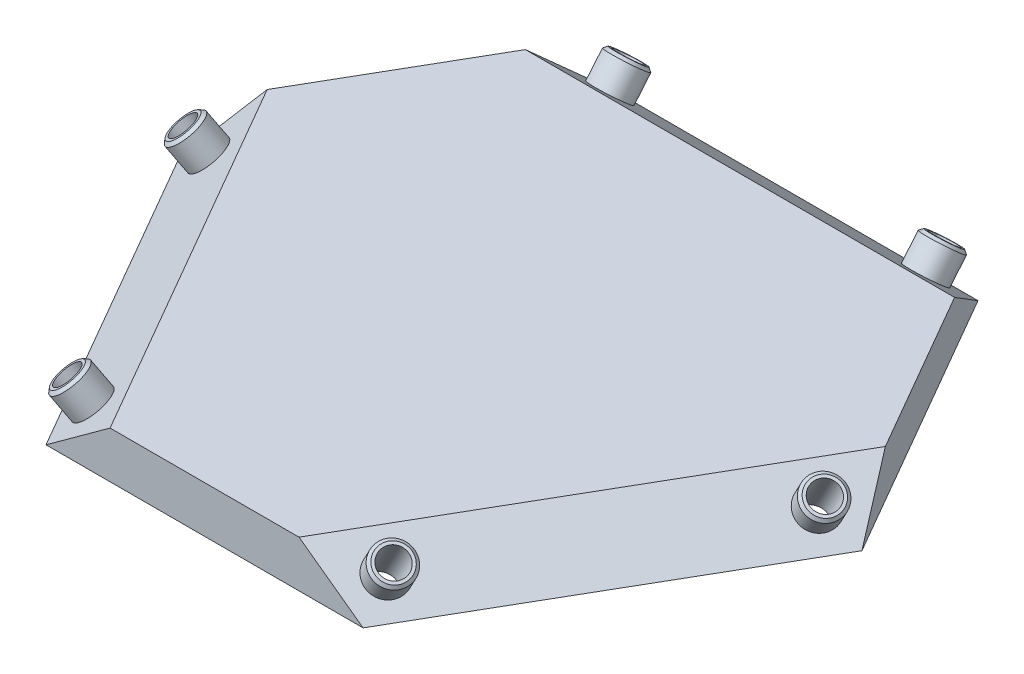
from build123d import *

# Parameters (mm, degrees)
BOSS_EXTRUDE1_DEPTH = 8
CHAMFER1_SIZE       = 10
CHAMFER1_SIZE_2     = 11.917535926
SKETCH4_R           = 2.3
CUT_EXTRUDE1_DEPTH  = 101.029376687
SKETCH7_R           = 2.3
CUT_EXTRUDE2_DEPTH  = 97.338690096
SKETCH6_R           = 2.3
CUT_EXTRUDE3_DEPTH  = 101.029376687
BOSS_EXTRUDE2_START = 5
SKETCH8_R           = 3.3
SKETCH8_R_2         = 2.3
BOSS_EXTRUDE2_DEPTH = 5
BOSS_EXTRUDE3_START = 5
SKETCH9_R           = 3.3
SKETCH9_R_2         = 2.3
BOSS_EXTRUDE3_DEPTH = 5
BOSS_EXTRUDE4_START = 5
SKETCH10_R          = 3.3
SKETCH10_R_2        = 2.3
BOSS_EXTRUDE4_DEPTH = 5
CHAMFER2_SIZE       = 0.5


with BuildPart() as part:
    # Sketch1 → Boss-Extrude1 (new body)
    with BuildSketch(Plane(origin=(0, 0, 0), x_dir=(1, 0, 0), z_dir=(0, 1, 0))):
        Polygon((-60, 0), (-30, -51.961524227), (30, -51.961524227), (60, 0), (30, 51.961524227), (-30, 51.961524227), align=None)
    extrude(amount=BOSS_EXTRUDE1_DEPTH)

    # Chamfer1
    # the kernel refuses this chamfer: 11.917535926, 10 mm, written as the material it takes off along each edge
    with BuildSketch(Plane(origin=(60.716329832, 8, -51.961524227), x_dir=(0, -0.9993728857116146, -0.0354095369136628), z_dir=(-1, 0, 0)), Plane(origin=(-75.358164916, 8, -26.601121946), x_dir=(-0.030665558503474466, -0.9993728857116146, 0.017704768456831187), z_dir=(0.4999999999999998, 0, 0.8660254037844388)), Plane(origin=(14.641835084, 8, 78.562646173), x_dir=(0.03066555850347504, -0.9993728857116146, 0.017704768456831523), z_dir=(0.4999999999999999, 0, -0.8660254037844388))) as chamfer1_piece_1:
        Polygon((CHAMFER1_SIZE * 0.999372885712, CHAMFER1_SIZE * 0.0354095369137), (-CHAMFER1_SIZE_2 * 0.0354095369135, CHAMFER1_SIZE_2 * 0.999372885707), (0, 0), align=None)
    extrude(amount=121.432659665, mode=Mode.SUBTRACT)

    # Sketch4 → Cut-Extrude1 (cut, through all)
    with BuildSketch(Plane(origin=(17.740047471, 24.412407781, 10.242221183), x_dir=(0.8301060005968417, -0.4979011414928852, -0.2510348204397117), z_dir=(0.5566703992264165, 0.766044443118981, 0.3213938048432679))):
        with Locations(Location((41.75562393, 0.929232239, 0), (0, 0, 164.627134315))):
            Circle(SKETCH4_R)
        with Locations(Location((7.440666851, -41.097835456, 0), (0, 0, 164.627134315))):
            Circle(SKETCH4_R)
    extrude(amount=-CUT_EXTRUDE1_DEPTH, mode=Mode.SUBTRACT)

    # Sketch7 → Cut-Extrude2 (cut, through all)
    with BuildSketch(Plane(origin=(0, 24.412407781, -20.484442365), x_dir=(1, 0, 0), z_dir=(0, 0.7660444431189811, -0.6427876096865357))):
        with Locations(Location((-27.128355545, 31.756069148, 0), (0, 0, 270))):
            Circle(SKETCH7_R)
        with Locations(Location((27.128355545, 31.756069148, 0), (0, 0, 270))):
            Circle(SKETCH7_R)
    extrude(amount=-CUT_EXTRUDE2_DEPTH, mode=Mode.SUBTRACT)

    # Sketch6 → Cut-Extrude3 (cut, through all)
    with BuildSketch(Plane(origin=(-17.740047471, 24.412407781, 10.242221183), x_dir=(0.8307334510088673, 0.5133226132381532, 0.21536440772154375), z_dir=(-0.5566703992264166, 0.766044443118981, 0.3213938048432678))):
        with Locations(Location((-41.687976983, 2.551112975, 0), (0, 0, 193.145847187))):
            Circle(SKETCH6_R)
        with Locations(Location((-9.032068506, -40.777657373, 0), (0, 0, 193.145847187))):
            Circle(SKETCH6_R)
    extrude(amount=-CUT_EXTRUDE3_DEPTH, mode=Mode.SUBTRACT)

    # Sketch8 → Boss-Extrude2 (add)
    # profile 1 of 2: a face of its own
    with BuildSketch(Plane(origin=(17.740047471, 24.412407781, 10.242221183), x_dir=(0.8307334510088674, -0.5133226132381531, -0.21536440772154372), z_dir=(0.5566703992264164, 0.766044443118981, 0.32139380484326796)).offset(BOSS_EXTRUDE2_START)):
        with Locations(Location((9.032068506, -40.777657373, 0), (0, 0, 166.854152813))):
            Circle(SKETCH8_R)
        with Locations(Location((9.032068506, -40.777657373, 0), (0, 0, 166.854152813))):
            Circle(SKETCH8_R_2, mode=Mode.SUBTRACT)
    # profile 2 of 2: a face of its own
    with BuildSketch(Plane(origin=(17.740047471, 24.412407781, 10.242221183), x_dir=(0.8307334510088674, -0.5133226132381531, -0.21536440772154372), z_dir=(0.5566703992264164, 0.766044443118981, 0.32139380484326796)).offset(BOSS_EXTRUDE2_START)):
        with Locations(Location((41.687976983, 2.551112975, 0), (0, 0, 166.854152813))):
            Circle(SKETCH8_R)
        with Locations(Location((41.687976983, 2.551112975, 0), (0, 0, 166.854152813))):
            Circle(SKETCH8_R_2, mode=Mode.SUBTRACT)
    extrude(amount=-BOSS_EXTRUDE2_DEPTH)

    # Sketch9 → Boss-Extrude3 (add)
    # profile 1 of 2: a face of its own
    with BuildSketch(Plane(origin=(-17.740047471, 24.412407781, 10.242221183), x_dir=(0.8307334510088673, 0.5133226132381532, 0.21536440772154375), z_dir=(-0.5566703992264166, 0.766044443118981, 0.3213938048432678)).offset(BOSS_EXTRUDE3_START)):
        with Locations(Location((-41.687976983, 2.551112975, 0), (0, 0, 193.145847187))):
            Circle(SKETCH9_R)
        with Locations(Location((-41.687976983, 2.551112975, 0), (0, 0, 193.145847187))):
            Circle(SKETCH9_R_2, mode=Mode.SUBTRACT)
    # profile 2 of 2: a face of its own
    with BuildSketch(Plane(origin=(-17.740047471, 24.412407781, 10.242221183), x_dir=(0.8307334510088673, 0.5133226132381532, 0.21536440772154375), z_dir=(-0.5566703992264166, 0.766044443118981, 0.3213938048432678)).offset(BOSS_EXTRUDE3_START)):
        with Locations(Location((-9.032068506, -40.777657373, 0), (0, 0, 193.145847187))):
            Circle(SKETCH9_R)
        with Locations(Location((-9.032068506, -40.777657373, 0), (0, 0, 193.145847187))):
            Circle(SKETCH9_R_2, mode=Mode.SUBTRACT)
    extrude(amount=-BOSS_EXTRUDE3_DEPTH)

    # Sketch10 → Boss-Extrude4 (add)
    # profile 1 of 2: a face of its own
    with BuildSketch(Plane(origin=(0, 24.412407781, -20.484442365), x_dir=(1, 0, 0), z_dir=(0, 0.7660444431189811, -0.6427876096865357)).offset(BOSS_EXTRUDE4_START)):
        with Locations(Location((-27.128355545, 31.756069148, 0), (0, 0, 270))):
            Circle(SKETCH10_R)
        with Locations(Location((-27.128355545, 31.756069148, 0), (0, 0, 270))):
            Circle(SKETCH10_R_2, mode=Mode.SUBTRACT)
    # profile 2 of 2: a face of its own
    with BuildSketch(Plane(origin=(0, 24.412407781, -20.484442365), x_dir=(1, 0, 0), z_dir=(0, 0.7660444431189811, -0.6427876096865357)).offset(BOSS_EXTRUDE4_START)):
        with Locations(Location((27.128355545, 31.756069148, 0), (0, 0, 270))):
            Circle(SKETCH10_R)
        with Locations(Location((27.128355545, 31.756069148, 0), (0, 0, 270))):
            Circle(SKETCH10_R_2, mode=Mode.SUBTRACT)
    extrude(amount=-BOSS_EXTRUDE4_DEPTH)

    # Chamfer2
    chamfer2_edges = [part.edges().sort_by_distance(p)[0] for p in [
        (27.128355545, 5.709023104, -50.552887382),
        (30.696220434, 5.890287901, 47.506315425),
        (57.824575979, 5.890287901, 0.518625295),
        (-52.485416923, 9.77015653, 0.518625295),
        (-25.357061378, 9.77015653, 47.506315425),
        (-27.128355545, 5.709023104, -50.552887382),
    ]]
    chamfer(chamfer2_edges, length=CHAMFER2_SIZE)


solid = part.part
